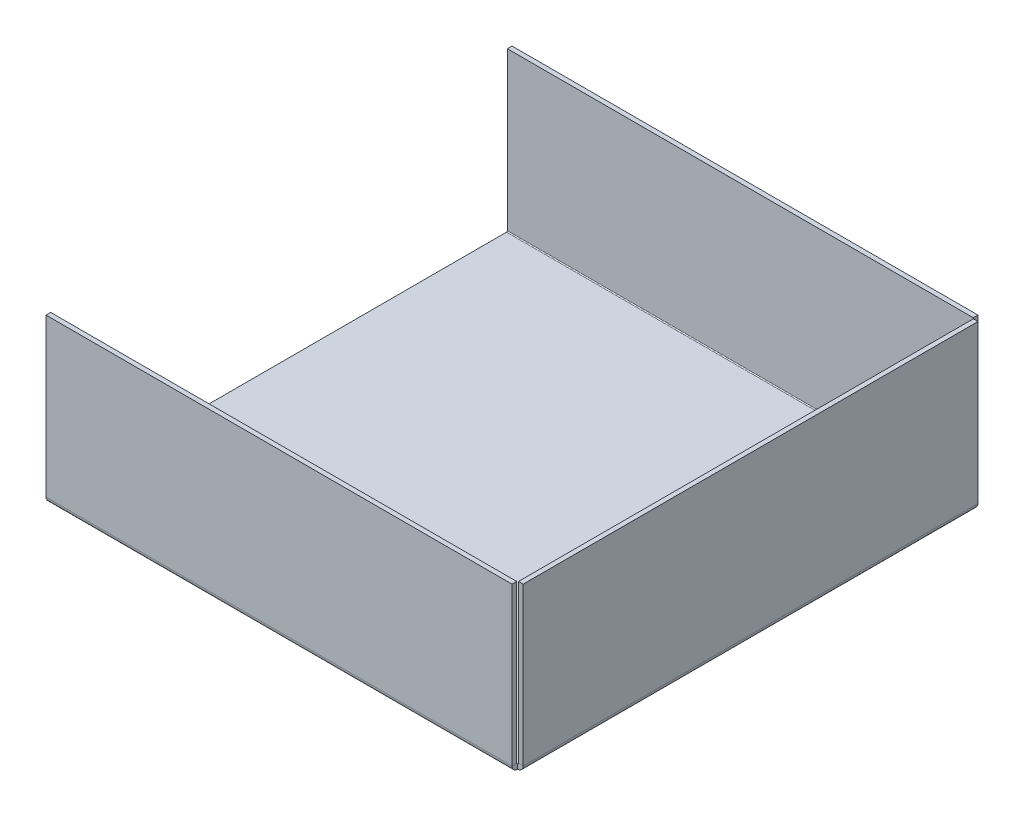
from build123d import *

# Parameters (mm, degrees)
SM_BASE_FLANGE_1_DEPTH = 100
SM_EDGE_FLANGE_1_DEPTH = 97.6


# Sheet-metal steps are written as plain solids
with BuildPart() as part:
    # Sketch 1 → 基体-法兰1 (new body)
    with BuildSketch(Plane(origin=(0, 0, 0), x_dir=(0, 0, -1), z_dir=(1, 0, 0))):
        with BuildLine():
            Line((0, 35), (0, 1.2))
            ThreePointArc((0, 1.2), (0.351471863, 0.351471863), (1.2, 0))
            Line((1.2, 0), (98.8, 0))
            ThreePointArc((98.8, 0), (99.648528137, 0.351471863), (100, 1.2))
            Line((100, 1.2), (100, 35))
            Line((100, 35), (99, 35))
            Line((99, 35), (99, 1.2))
            ThreePointArc((99, 1.2), (98.941421356, 1.058578644), (98.8, 1))
            Line((98.8, 1), (1.2, 1))
            ThreePointArc((1.2, 1), (1.058578644, 1.058578644), (1, 1.2))
            Line((1, 1.2), (1, 35))
            Line((1, 35), (0, 35))
        make_face()
    extrude(amount=SM_BASE_FLANGE_1_DEPTH)

    # 边线-法兰1 section (across the edge) → 边线-法兰1 (add)
    with BuildSketch(Plane(origin=(100.2, 1, -1.2), x_dir=(-1, 0, 0), z_dir=(0, 0, -1))):
        with BuildLine():
            Line((-1, 0.2), (-1, 34))
            Line((-1, 34), (0, 34))
            Line((0, 34), (0, 0.2))
            ThreePointArc((0, 0.2), (0.058578644, 0.058578644), (0.2, 0))
            Line((0.2, 0), (0.2, -1))
            ThreePointArc((0.2, -1), (-0.648528137, -0.648528137), (-1, 0.2))
        make_face()
    extrude(amount=SM_EDGE_FLANGE_1_DEPTH)


solid = part.part
